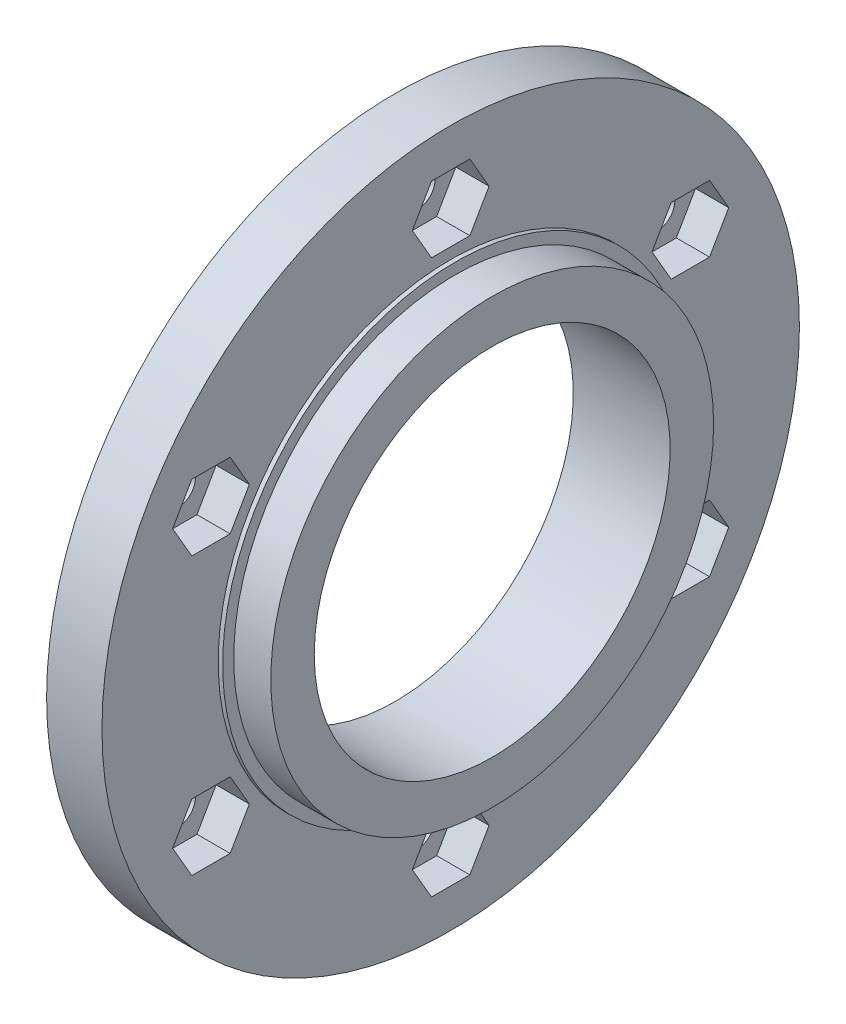
from build123d import *

# Parameters (mm, degrees)
SKIZZE2_R                        = 16.075
SCHNITT_LINEAR_AUSTRAGEN1_DEPTH  = 46.398926199
SCHNITT_LINEAR_AUSTRAGEN2_DEPTH  = 3
KREISMUSTER1_COUNT               = 6
F_3_2_3_2_DURCHMESSER_BOHRUNG1_D = 3.2
KREISMUSTER2_COUNT               = 6


with BuildPart() as part:
    # Skizze1 → Rotation1 (revolve)
    with BuildSketch(Plane.XY):
        Polygon((0, 0), (0, 31.5), (5, 31.5), (5, 21), (5.4, 21), (5.4, 20), (8.75, 20), (8.75, 0), align=None)
    revolve(axis=Axis((0, 0, 0), (-1, 0, 0)))

    # Skizze2 → Schnitt-Linear austragen1 (cut, through all)
    with BuildSketch(Plane.ZY):
        Circle(SKIZZE2_R)
    extrude(amount=-SCHNITT_LINEAR_AUSTRAGEN1_DEPTH, mode=Mode.SUBTRACT)

    # Skizze3 → Schnitt-Linear austragen2 (cut)
    with BuildSketch(Plane(origin=(5, 0, 0), x_dir=(0, 0, -1), z_dir=(1, 0, 0))):
        Polygon((1.732050808, 22), (3.464101615, 25), (1.732050808, 28), (-1.732050808, 28), (-3.464101615, 25), (-1.732050808, 22), align=None)
    schnitt_linear_austragen2 = extrude(amount=-SCHNITT_LINEAR_AUSTRAGEN2_DEPTH, mode=Mode.SUBTRACT)

    # Kreismuster1: Schnitt-Linear austragen2 ×6 about axis
    kreismuster1_axis = Axis((8.75, 0, 0), (-1, 0, 0))
    for i in range(1, KREISMUSTER1_COUNT):
        add(schnitt_linear_austragen2.rotate(kreismuster1_axis, i * 360 / KREISMUSTER1_COUNT), mode=Mode.SUBTRACT)

    # Ø3.2 (3.2) Durchmesser Bohrung1 (through all)
    with Locations(Plane(origin=(5, 0, 0), x_dir=(0, 0, -1), z_dir=(1, 0, 0))):
        with Locations((0, 25)):
            f_3_2_3_2_durchmesser_bohrung1 = Hole(F_3_2_3_2_DURCHMESSER_BOHRUNG1_D / 2)

    # Kreismuster2: Ø3.2 (3.2) Durchmesser Bohrung1 ×6 about axis
    kreismuster2_axis = Axis((8.75, 0, 0), (-1, 0, 0))
    for i in range(1, KREISMUSTER2_COUNT):
        add(f_3_2_3_2_durchmesser_bohrung1.rotate(kreismuster2_axis, i * 360 / KREISMUSTER2_COUNT), mode=Mode.SUBTRACT)


solid = part.part
